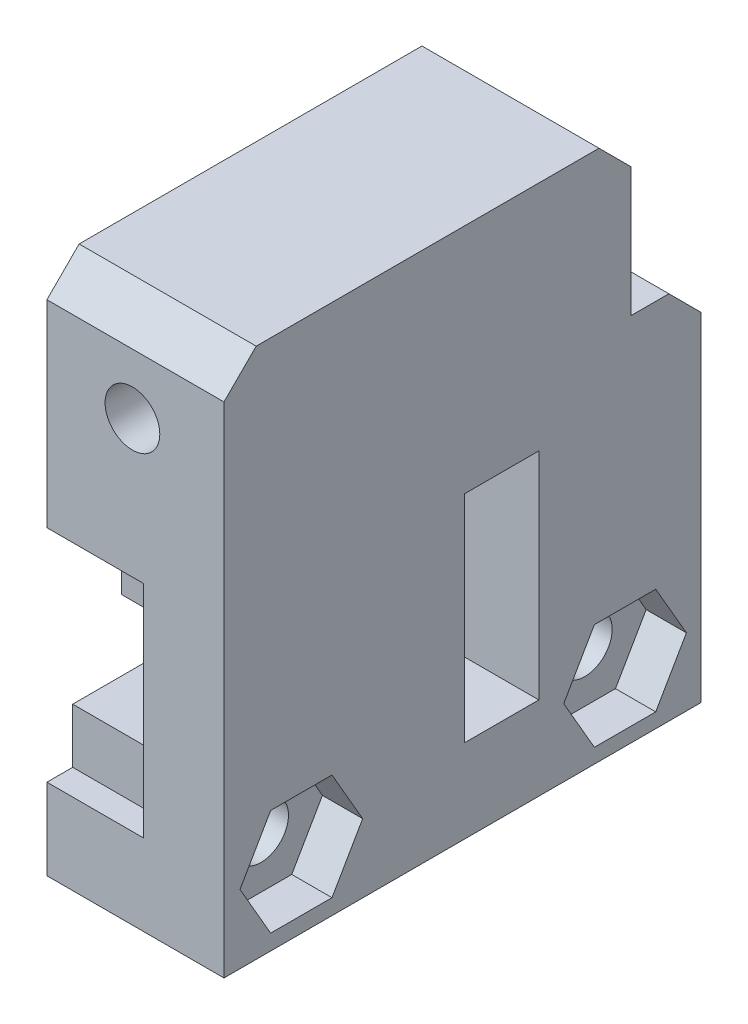
from build123d import *

# Parameters (mm, degrees)
SKETCH1_W           = 29.64084851
SKETCH1_H           = 22.995210284
BOSS_EXTRUDE1_DEPTH = 11
SKETCH2_W           = 11
SKETCH2_H           = 25.30011898
BOSS_EXTRUDE2_DEPTH = 10
CHAMFER1_SIZE       = 2
SKETCH3_W           = 31.444464136
SKETCH3_H           = 13.690550156
CUT_EXTRUDE2_DEPTH  = 6
SKETCH4_W           = 16.801230495
SKETCH4_H           = 6.210132239
BOSS_EXTRUDE3_DEPTH = 10
SKETCH5_R           = 2.040999549
CUT_EXTRUDE3_DEPTH  = 33.013106791
SKETCH6_W           = 4.621469737
SKETCH6_H           = 13.3986797
CUT_EXTRUDE4_DEPTH  = 31.112987264
SKETCH7_R           = 1.7
CUT_EXTRUDE5_DEPTH  = 27
SKETCH21_W          = 6.4100694
SKETCH21_H          = 8.3354859
BOSS_EXTRUDE4_DEPTH = 11
SKETCH20_W          = 6.410069378
SKETCH20_H          = 8.335485858
BOSS_EXTRUDE5_DEPTH = 11
CUT_EXTRUDE6_DEPTH  = 2.5
SKETCH19_R          = 1.7
CUT_EXTRUDE7_DEPTH  = 31.112987264
CUT_EXTRUDE8_DEPTH  = 2.5
SKETCH18_R          = 1.7
CUT_EXTRUDE9_DEPTH  = 31.112987264


with BuildPart() as part:
    # Sketch1 → Boss-Extrude1 (new body)
    with BuildSketch(Plane(origin=(0, 0, 0), x_dir=(0, 0, -1), z_dir=(1, 0, 0))):
        Rectangle(SKETCH1_W, SKETCH1_H)
    extrude(amount=BOSS_EXTRUDE1_DEPTH)

    # Sketch2 → Boss-Extrude2 (add)
    with BuildSketch(Plane(origin=(0, 11.497605142, 0), x_dir=(1, 0, 0), z_dir=(0, 1, 0))):
        with Locations((5.5, -2.170364765)):
            Rectangle(SKETCH2_W, SKETCH2_H)
    extrude(amount=BOSS_EXTRUDE2_DEPTH)

    # Chamfer1
    chamfer1_edges = [part.edges().sort_by_distance(p)[0] for p in [
        (5.5, 11.497605142, -14.820424255),
        (5.5, 21.497605142, -10.479694725),
        (5.5, 21.497605142, 14.820424255),
    ]]
    chamfer(chamfer1_edges, length=CHAMFER1_SIZE)

    # Sketch3 → Cut-Extrude2 (cut)
    with BuildSketch(Plane.ZY):
        with Locations((0.26445091, 0.38357275)):
            Rectangle(SKETCH3_W, SKETCH3_H)
    extrude(amount=-CUT_EXTRUDE2_DEPTH, mode=Mode.SUBTRACT)

    # Sketch4 → Boss-Extrude3 (add)
    with BuildSketch(Plane(origin=(6, 0.435062227, 0), x_dir=(0, 0, 1), z_dir=(-1, 0, 0))):
        with Locations((-2.204570257, -0.002306757)):
            Rectangle(SKETCH4_W, SKETCH4_H)
    extrude(amount=BOSS_EXTRUDE3_DEPTH)

    # Sketch5 → Cut-Extrude3 (cut, through all)
    with BuildSketch(Plane.XY.offset(6.196044991)):
        with Locations((0.212787141, 0.369675098)):
            Circle(SKETCH5_R)
    extrude(amount=-CUT_EXTRUDE3_DEPTH, mode=Mode.SUBTRACT)

    # Sketch6 → Cut-Extrude4 (cut, through all)
    with BuildSketch(Plane(origin=(11, 0, 0), x_dir=(0, 0, -1), z_dir=(1, 0, 0))):
        with Locations((2.429578273, 0.383063563)):
            Rectangle(SKETCH6_W, SKETCH6_H)
    extrude(amount=-CUT_EXTRUDE4_DEPTH, mode=Mode.SUBTRACT)

    # Sketch7 → Cut-Extrude5 (cut)
    with BuildSketch(Plane.XY.offset(14.820424255)):
        with Locations((5.312142967, 15.762432364)):
            Circle(SKETCH7_R)
    extrude(amount=-CUT_EXTRUDE5_DEPTH, mode=Mode.SUBTRACT)

    # Sketch21 → Boss-Extrude4 (add)
    with BuildSketch(Plane(origin=(11, 0, 0), x_dir=(0, 0, -1), z_dir=(1, 0, 0))):
        with Locations((10.097369078, -7.290376311)):
            Rectangle(SKETCH21_W, SKETCH21_H)
    extrude(amount=-BOSS_EXTRUDE4_DEPTH)

    # Sketch20 → Boss-Extrude5 (add)
    with BuildSketch(Plane(origin=(11, 0, 0), x_dir=(0, 0, -1), z_dir=(1, 0, 0))):
        with Locations((-10.015073396, -7.232029734)):
            Rectangle(SKETCH20_W, SKETCH20_H)
    extrude(amount=-BOSS_EXTRUDE5_DEPTH)

    # Sketch15 → Cut-Extrude6 (cut)
    with BuildSketch(Plane(origin=(11, 0, 0), x_dir=(0, 0, -1), z_dir=(1, 0, 0))):
        Polygon((-8.109817508, -10.532029734), (-6.204561619, -7.232029734), (-8.109817508, -3.932029734), (-11.920329284, -3.932029734), (-13.825585173, -7.232029734), (-11.920329284, -10.532029734), align=None)
    extrude(amount=-CUT_EXTRUDE6_DEPTH, mode=Mode.SUBTRACT)

    # Sketch19 → Cut-Extrude7 (cut, through all)
    with BuildSketch(Plane(origin=(11, 0, 0), x_dir=(0, 0, -1), z_dir=(1, 0, 0))):
        with Locations((-10.015073396, -7.232029734)):
            Circle(SKETCH19_R)
    extrude(amount=-CUT_EXTRUDE7_DEPTH, mode=Mode.SUBTRACT)

    # Sketch17 → Cut-Extrude8 (cut)
    with BuildSketch(Plane(origin=(11, 0, 0), x_dir=(0, 0, -1), z_dir=(1, 0, 0))):
        Polygon((12.002624966, -10.590376311), (13.907880854, -7.290376311), (12.002624966, -3.990376311), (8.192113189, -3.990376311), (6.286857301, -7.290376311), (8.192113189, -10.590376311), align=None)
    extrude(amount=-CUT_EXTRUDE8_DEPTH, mode=Mode.SUBTRACT)

    # Sketch18 → Cut-Extrude9 (cut, through all)
    with BuildSketch(Plane(origin=(11, 0, 0), x_dir=(0, 0, -1), z_dir=(1, 0, 0))):
        with Locations((10.097369078, -7.290376311)):
            Circle(SKETCH18_R)
    extrude(amount=-CUT_EXTRUDE9_DEPTH, mode=Mode.SUBTRACT)


solid = part.part
